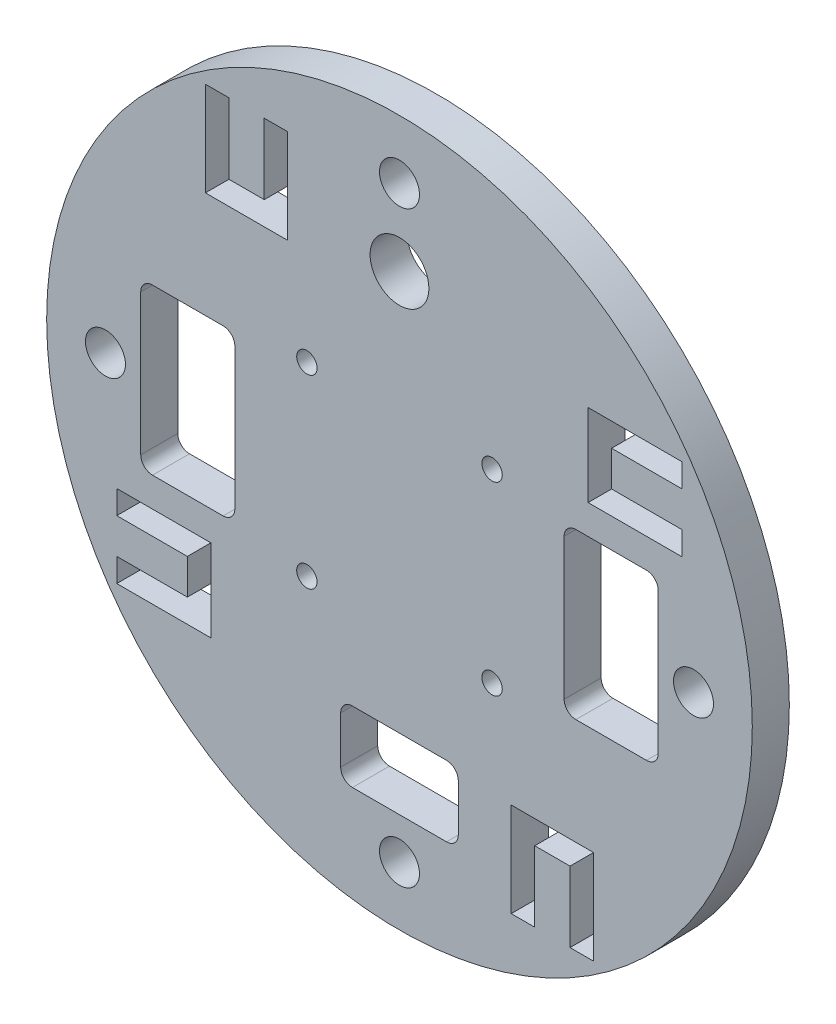
from build123d import *

# Parameters (mm, degrees)
SKETCH1_R               = 38.1
BOSS_EXTRUDE1_DEPTH     = 4
SKETCH2_R               = 1.1
CUT_EXTRUDE1_DEPTH      = 55.029806589
CUT_EXTRUDE2_DEPTH      = 55.029806589
CUT_EXTRUDE2_DEPTH_BACK = 55.029806589
SKETCH3_R               = 2.159
CUT_EXTRUDE3_DEPTH      = 55.029806589
CUT_EXTRUDE3_DEPTH_BACK = 55.029806589
CUT_EXTRUDE4_REACH      = 56.03
SKETCH5_R               = 3.175
CUT_EXTRUDE5_REACH      = 56.03


with BuildPart() as part:
    # Sketch1 → Boss-Extrude1 (new body)
    with BuildSketch(Plane.XY):
        Circle(SKETCH1_R)
    extrude(amount=BOSS_EXTRUDE1_DEPTH)

    # Sketch2 → Cut-Extrude1 (cut, through all)
    with BuildSketch(Plane.XY.offset(4)):
        with Locations((10, 10)):
            Circle(SKETCH2_R)
        with Locations((10, -10)):
            Circle(SKETCH2_R)
        with Locations((-10, -10)):
            Circle(SKETCH2_R)
        with Locations((-10, 10)):
            Circle(SKETCH2_R)
    extrude(amount=-CUT_EXTRUDE1_DEPTH, mode=Mode.SUBTRACT)

    # Sketch3 → Cut-Extrude2 (cut, two sides: drawn at the far end of the back side and taken through both)
    with BuildSketch(Plane.XY.offset(4).offset(-CUT_EXTRUDE2_DEPTH_BACK)):
        with Locations((0, -31.75)):
            Circle(SKETCH3_R)
        with Locations((-31.75, 0)):
            Circle(SKETCH3_R)
        with Locations((0, 31.75)):
            Circle(SKETCH3_R)
        with Locations((31.75, 0)):
            Circle(SKETCH3_R)
    extrude(amount=CUT_EXTRUDE2_DEPTH + CUT_EXTRUDE2_DEPTH_BACK, mode=Mode.SUBTRACT)

    # Sketch4 → Cut-Extrude3 (cut, two sides: drawn at the far end of the back side and taken through both)
    with BuildSketch(Plane.XY.offset(4).offset(-CUT_EXTRUDE3_DEPTH_BACK)):
        with BuildLine():
            Line((-19.05, -8.89), (-26.67, -8.89))
            ThreePointArc((-26.67, -8.89), (-27.568025612, -8.518025612), (-27.94, -7.62))
            Line((-27.94, -7.62), (-27.94, 7.62))
            ThreePointArc((-27.94, 7.62), (-27.568025612, 8.518025612), (-26.67, 8.89))
            Line((-26.67, 8.89), (-19.05, 8.89))
            ThreePointArc((-19.05, 8.89), (-18.151974388, 8.518025612), (-17.78, 7.62))
            Line((-17.78, 7.62), (-17.78, -7.62))
            ThreePointArc((-17.78, -7.62), (-18.151974388, -8.518025612), (-19.05, -8.89))
        make_face()
        with BuildLine():
            Line((19.05, 8.89), (26.67, 8.89))
            ThreePointArc((26.67, 8.89), (27.568025612, 8.518025612), (27.94, 7.62))
            Line((27.94, 7.62), (27.94, -7.62))
            ThreePointArc((27.94, -7.62), (27.568025612, -8.518025612), (26.67, -8.89))
            Line((26.67, -8.89), (19.05, -8.89))
            ThreePointArc((19.05, -8.89), (18.151974388, -8.518025612), (17.78, -7.62))
            Line((17.78, -7.62), (17.78, 7.62))
            ThreePointArc((17.78, 7.62), (18.151974388, 8.518025612), (19.05, 8.89))
        make_face()
    extrude(amount=CUT_EXTRUDE3_DEPTH + CUT_EXTRUDE3_DEPTH_BACK, mode=Mode.SUBTRACT)

    # Sketch5 → Cut-Extrude4 (cut, up to next)
    with BuildSketch(Plane.XY.offset(4), mode=Mode.PRIVATE) as cut_extrude4_sk1:
        with Locations((0, 23.495)):
            Circle(SKETCH5_R)
    cut_extrude4_tool1 = extrude(cut_extrude4_sk1.sketch, amount=-CUT_EXTRUDE4_REACH, mode=Mode.PRIVATE) & part.part
    # Sketch5 → Cut-Extrude4 (cut, up to next)
    with BuildSketch(Plane.XY.offset(4), mode=Mode.PRIVATE) as cut_extrude4_sk2:
        with BuildLine():
            Line((-5.08, -27.305), (5.08, -27.305))
            ThreePointArc((5.08, -27.305), (5.978025612, -26.933025612), (6.35, -26.035))
            Line((6.35, -26.035), (6.35, -20.955))
            ThreePointArc((6.35, -20.955), (5.978025612, -20.056974388), (5.08, -19.685))
            Line((5.08, -19.685), (-5.08, -19.685))
            ThreePointArc((-5.08, -19.685), (-5.978025612, -20.056974388), (-6.35, -20.955))
            Line((-6.35, -20.955), (-6.35, -26.035))
            ThreePointArc((-6.35, -26.035), (-5.978025612, -26.933025612), (-5.08, -27.305))
        make_face()
    cut_extrude4_tool2 = extrude(cut_extrude4_sk2.sketch, amount=-CUT_EXTRUDE4_REACH, mode=Mode.PRIVATE) & part.part
    add(cut_extrude4_tool1.solids().sort_by_distance((0, 23.495, 4))[0], mode=Mode.SUBTRACT)
    add(cut_extrude4_tool2.solids().sort_by_distance((0, -23.495, 4))[0], mode=Mode.SUBTRACT)

    # Sketch6 → Cut-Extrude5 (cut, up to next)
    with BuildSketch(Plane.XY.offset(4), mode=Mode.PRIVATE) as cut_extrude5_sk1:
        Polygon((-18.415, 22.90700482), (-14.605, 22.90700482), (-14.605, 30.52700482), (-12.065, 30.52700482), (-12.065, 20.36700482), (-20.955, 20.36700482), (-20.955, 30.52700482), (-18.415, 30.52700482), align=None)
    cut_extrude5_tool1 = extrude(cut_extrude5_sk1.sketch, amount=-CUT_EXTRUDE5_REACH, mode=Mode.PRIVATE) & part.part
    # Sketch6 → Cut-Extrude5 (cut, up to next)
    with BuildSketch(Plane.XY.offset(4), mode=Mode.PRIVATE) as cut_extrude5_sk2:
        Polygon((22.90700482, 18.415), (22.90700482, 14.605), (30.52700482, 14.605), (30.52700482, 12.065), (20.36700482, 12.065), (20.36700482, 20.955), (30.52700482, 20.955), (30.52700482, 18.415), align=None)
    cut_extrude5_tool2 = extrude(cut_extrude5_sk2.sketch, amount=-CUT_EXTRUDE5_REACH, mode=Mode.PRIVATE) & part.part
    # Sketch6 → Cut-Extrude5 (cut, up to next)
    with BuildSketch(Plane.XY.offset(4), mode=Mode.PRIVATE) as cut_extrude5_sk3:
        Polygon((18.415, -22.90700482), (14.605, -22.90700482), (14.605, -30.52700482), (12.065, -30.52700482), (12.065, -20.36700482), (20.955, -20.36700482), (20.955, -30.52700482), (18.415, -30.52700482), align=None)
    cut_extrude5_tool3 = extrude(cut_extrude5_sk3.sketch, amount=-CUT_EXTRUDE5_REACH, mode=Mode.PRIVATE) & part.part
    # Sketch6 → Cut-Extrude5 (cut, up to next)
    with BuildSketch(Plane.XY.offset(4), mode=Mode.PRIVATE) as cut_extrude5_sk4:
        Polygon((-22.90700482, -18.415), (-22.90700482, -14.605), (-30.52700482, -14.605), (-30.52700482, -12.065), (-20.36700482, -12.065), (-20.36700482, -20.955), (-30.52700482, -20.955), (-30.52700482, -18.415), align=None)
    cut_extrude5_tool4 = extrude(cut_extrude5_sk4.sketch, amount=-CUT_EXTRUDE5_REACH, mode=Mode.PRIVATE) & part.part
    add(cut_extrude5_tool1.solids().sort_by_distance((-16.51, 22.772002, 4))[0], mode=Mode.SUBTRACT)
    add(cut_extrude5_tool2.solids().sort_by_distance((22.772002, 16.51, 4))[0], mode=Mode.SUBTRACT)
    add(cut_extrude5_tool3.solids().sort_by_distance((16.51, -22.772002, 4))[0], mode=Mode.SUBTRACT)
    add(cut_extrude5_tool4.solids().sort_by_distance((-22.772002, -16.51, 4))[0], mode=Mode.SUBTRACT)


solid = part.part
